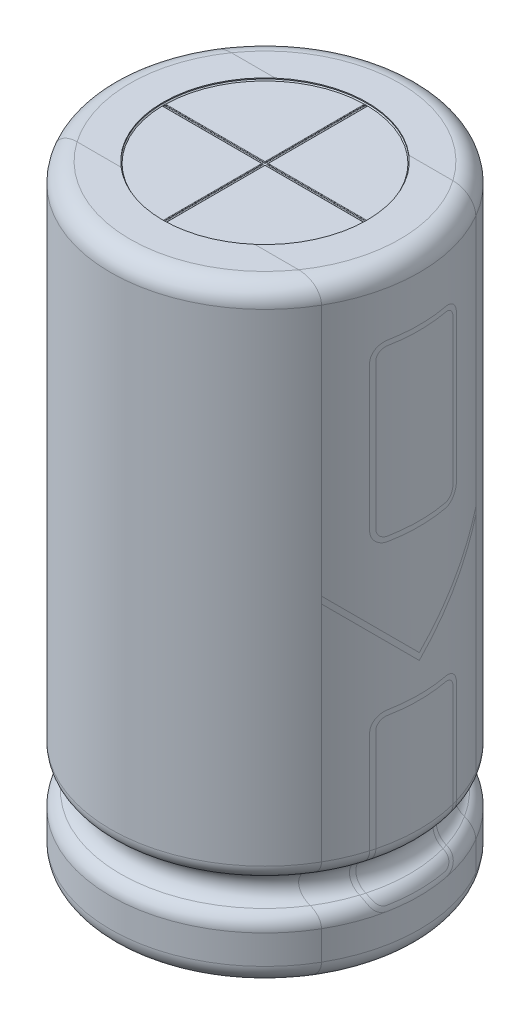
from build123d import *

# Parameters (mm, degrees)
BODY_PLANO_R            = 8
BODY_DEPTH              = 31.5
FILLET_F1_R             = 1
FILLET_F2_R             = 1
HS_CROQUIS_R            = 5.291502622
HUECO_SUPERIOR_DEPTH    = 0.1
HI_CROQUIS_R            = 6.5
HUECO_INFERIOR_DEPTH    = 0.1
CHAFLAN_HUECOS_SIZE     = 0.05
CORTAR_EXTRUIR1_DEPTH   = 0.05
REDONDEO3_R             = 0.025
CROQUIS2_R              = 0.4
SALIENTE_EXTRUIR1_DEPTH = 1.9
REDONDEO1_R             = 0.2


with BuildPart() as part:
    # Body_Plano → Body (new body)
    with BuildSketch(Plane(origin=(0, 0, 0), x_dir=(1, 0, 0), z_dir=(0, 1, 0))):
        with Locations(Location((0, 0, 0), (0, 0, 270))):
            Circle(BODY_PLANO_R)
    extrude(amount=BODY_DEPTH)

    # Cintura_Plano → Cintura (revolve, cut)
    with BuildSketch(Plane.XY, mode=Mode.PRIVATE) as cintura_sk:
        with BuildLine():
            Line((-8, 2.5), (-8, 5.5))
            ThreePointArc((-8, 5.5), (-7.863540864, 5.049306091), (-7.5, 4.75))
            ThreePointArc((-7.5, 4.75), (-7, 4), (-7.5, 3.25))
            ThreePointArc((-7.5, 3.25), (-7.863540864, 2.950693909), (-8, 2.5))
        make_face()
    revolve(cintura_sk.sketch.rotate(Axis((0, 0, 0), (0, 1, 0)), 270), axis=Axis((0, 0, 0), (0, 1, 0)), mode=Mode.SUBTRACT)

    # Fillet F1
    fillet_f1_edges = [part.edges().sort_by_distance(p)[0] for p in [
        (0, 31.5, -8),
    ]]
    fillet(fillet_f1_edges, radius=FILLET_F1_R)

    # Fillet F2
    fillet_f2_edges = [part.edges().sort_by_distance(p)[0] for p in [
        (0, 0, -8),
    ]]
    fillet(fillet_f2_edges, radius=FILLET_F2_R)

    # HS Croquis → Hueco Superior (cut)
    with BuildSketch(Plane(origin=(0, 31.5, 0), x_dir=(1, 0, 0), z_dir=(0, 1, 0))):
        with Locations(Location((0, 0, 0), (0, 0, 270))):
            Circle(HS_CROQUIS_R)
    extrude(amount=-HUECO_SUPERIOR_DEPTH, mode=Mode.SUBTRACT)

    # HI Croquis → Hueco Inferior (cut)
    with BuildSketch(Plane.XZ):
        with Locations(Location((0, 0, 0), (0, 0, 270))):
            Circle(HI_CROQUIS_R)
    extrude(amount=-HUECO_INFERIOR_DEPTH, mode=Mode.SUBTRACT)

    # Chaflan Huecos
    chaflan_huecos_edges = [part.edges().sort_by_distance(p)[0] for p in [
        (0, 31.4, -5.291502622),
        (0, 0.1, 6.5),
    ]]
    chamfer(chaflan_huecos_edges, length=CHAFLAN_HUECOS_SIZE)

    # Croquis3 → Cortar-Extruir1 (cut)
    with BuildSketch(Plane(origin=(0, 31.4, 0), x_dir=(1, 0, 0), z_dir=(0, 1, 0))):
        with BuildLine():
            Line((-0.0625, 5.241129982), (-0.0625, 0.0625))
            Line((-0.0625, 0.0625), (-5.241129982, 0.0625))
            ThreePointArc((-5.241129982, 0.0625), (-5.241502622, 0), (-5.241129982, -0.0625))
            Line((-5.241129982, -0.0625), (-0.0625, -0.0625))
            Line((-0.0625, -0.0625), (-0.0625, -5.241129982))
            ThreePointArc((-0.0625, -5.241129982), (0, -5.241502622), (0.0625, -5.241129982))
            Line((0.0625, -5.241129982), (0.0625, -0.0625))
            Line((0.0625, -0.0625), (5.241129982, -0.0625))
            ThreePointArc((5.241129982, -0.0625), (5.241502622, 0), (5.241129982, 0.0625))
            Line((5.241129982, 0.0625), (0.0625, 0.0625))
            Line((0.0625, 0.0625), (0.0625, 5.241129982))
            ThreePointArc((0.0625, 5.241129982), (0, 5.241502622), (-0.0625, 5.241129982))
        make_face()
    extrude(amount=-CORTAR_EXTRUIR1_DEPTH, mode=Mode.SUBTRACT)

    # Redondeo3
    # the kernel refuses this fillet: 0.025 mm, written as the material it adds along each edge
    with BuildSketch(Plane(origin=(0.0625, 31.35, 0.0625), x_dir=(0, 0, -1), z_dir=(1, 0, 0)), Plane(origin=(-5.303629982, 31.35, 0.0625), x_dir=(0, 0, -1), z_dir=(1, 0, 0)), Plane(origin=(-0.0625, 31.35, -0.0625), x_dir=(0, 0, 1), z_dir=(-1, 0, 0)), Plane(origin=(-0.0625, 31.35, -5.303629982), x_dir=(1, 0, 0), z_dir=(0, 0, 1)), Plane(origin=(0.0625, 31.35, -0.0625), x_dir=(-1, 0, 0), z_dir=(0, 0, -1)), Plane(origin=(5.303629982, 31.35, -0.0625), x_dir=(0, 0, 1), z_dir=(-1, 0, 0))) as redondeo3_piece_1:
        with BuildLine():
            CenterArc((REDONDEO3_R, REDONDEO3_R), REDONDEO3_R, 180, 90)
            Line((0, REDONDEO3_R), (0, 0))
            Line((0, 0), (REDONDEO3_R, 0))
        make_face()
    extrude(amount=5.241129982)
    with BuildSketch(Plane(origin=(0.0625, 31.35, 5.303629982), x_dir=(0, 1, 0), z_dir=(0, 0, -1)), Plane(origin=(-0.0625, 31.35, 0.0625), x_dir=(0, 1, 0), z_dir=(0, 0, 1))) as redondeo3_piece_2:
        with BuildLine():
            CenterArc((REDONDEO3_R, -REDONDEO3_R), REDONDEO3_R, 90, 90)
            Line((0, -REDONDEO3_R), (0, 0))
            Line((0, 0), (REDONDEO3_R, 0))
        make_face()
    extrude(amount=5.241129982)
    with BuildSketch(Plane(origin=(0, 31.35, 0), x_dir=(-0.023846146282340983, 0, 0.9997156402234993), z_dir=(-0.9997156402234993, 0, -0.023846146282340983))) as redondeo3_piece_3:
        with BuildLine():
            CenterArc((5.241502622 - REDONDEO3_R, REDONDEO3_R), REDONDEO3_R, 270, 90)
            Line((5.241502622 - REDONDEO3_R, 0), (5.241502622, 0))
            Line((5.241502622, 0), (5.241502622, REDONDEO3_R))
        make_face()
    revolve(axis=Axis((0, 31.35, 0), (0, 1, 0)), revolution_arc=2.732826119)
    with BuildSketch(Plane(origin=(0, 31.35, 0), x_dir=(-0.9997156402234993, 0, -0.023846146282340826), z_dir=(0.023846146282340826, 0, -0.9997156402234993))) as redondeo3_piece_4:
        with BuildLine():
            CenterArc((5.241502622 - REDONDEO3_R, REDONDEO3_R), REDONDEO3_R, 270, 90)
            Line((5.241502622 - REDONDEO3_R, 0), (5.241502622, 0))
            Line((5.241502622, 0), (5.241502622, REDONDEO3_R))
        make_face()
    revolve(axis=Axis((0, 31.35, 0), (0, 1, 0)), revolution_arc=2.732826119)
    with BuildSketch(Plane(origin=(0, 31.35, 0), x_dir=(0.023846146282340747, 0, -0.9997156402234993), z_dir=(0.9997156402234993, 0, 0.023846146282340747))) as redondeo3_piece_5:
        with BuildLine():
            CenterArc((5.241502622 - REDONDEO3_R, REDONDEO3_R), REDONDEO3_R, 270, 90)
            Line((5.241502622 - REDONDEO3_R, 0), (5.241502622, 0))
            Line((5.241502622, 0), (5.241502622, REDONDEO3_R))
        make_face()
    revolve(axis=Axis((0, 31.35, 0), (0, 1, 0)), revolution_arc=2.732826119)
    with BuildSketch(Plane(origin=(0, 31.35, 0), x_dir=(0.9997156402234993, 0, 0.023846146282341076), z_dir=(-0.023846146282341076, 0, 0.9997156402234993))) as redondeo3_piece_6:
        with BuildLine():
            CenterArc((5.241502622 - REDONDEO3_R, REDONDEO3_R), REDONDEO3_R, 270, 90)
            Line((5.241502622 - REDONDEO3_R, 0), (5.241502622, 0))
            Line((5.241502622, 0), (5.241502622, REDONDEO3_R))
        make_face()
    revolve(axis=Axis((0, 31.35, 0), (0, 1, 0)), revolution_arc=2.732826119)
    with BuildSketch(Plane(origin=(0.0625, 31.35, 5.303629982), x_dir=(0, 1, 0), z_dir=(0, 0, -1))) as redondeo3_piece_7a_section:
        with BuildLine():
            CenterArc((REDONDEO3_R, -REDONDEO3_R), REDONDEO3_R, 90, 90)
            Line((0, -REDONDEO3_R), (0, 0))
            Line((0, 0), (REDONDEO3_R, 0))
        make_face()
    redondeo3_piece_7a = extrude(amount=5.303629982, mode=Mode.PRIVATE)
    redondeo3_piece_7a = split(redondeo3_piece_7a, bisect_by=Plane(origin=(0.0625, 31.35, 0.0625), z_dir=(0, 0, -1)), keep=Keep.TOP, mode=Mode.PRIVATE)
    with BuildSketch(Plane(origin=(0, 31.35, 0.0625), x_dir=(0, 0, -1), z_dir=(1, 0, 0))) as redondeo3_piece_7b_section:
        with BuildLine():
            CenterArc((REDONDEO3_R, REDONDEO3_R), REDONDEO3_R, 180, 90)
            Line((0, REDONDEO3_R), (0, 0))
            Line((0, 0), (REDONDEO3_R, 0))
        make_face()
    redondeo3_piece_7b = extrude(amount=5.303629982, mode=Mode.PRIVATE)
    redondeo3_piece_7b = split(redondeo3_piece_7b, bisect_by=Plane(origin=(0.0625, 31.35, 0.0625), z_dir=(-1, 0, 0)), keep=Keep.TOP, mode=Mode.PRIVATE)
    redondeo3_piece_7 = redondeo3_piece_7a & redondeo3_piece_7b
    add(redondeo3_piece_7)
    with BuildSketch(Plane(origin=(-0.0625, 31.35, 0), x_dir=(0, 1, 0), z_dir=(0, 0, 1))) as redondeo3_piece_8a_section:
        with BuildLine():
            CenterArc((REDONDEO3_R, -REDONDEO3_R), REDONDEO3_R, 90, 90)
            Line((0, -REDONDEO3_R), (0, 0))
            Line((0, 0), (REDONDEO3_R, 0))
        make_face()
    redondeo3_piece_8a = extrude(amount=5.303629982, mode=Mode.PRIVATE)
    redondeo3_piece_8a = split(redondeo3_piece_8a, bisect_by=Plane(origin=(-0.0625, 31.35, 0.0625), z_dir=(0, 0, -1)), keep=Keep.TOP, mode=Mode.PRIVATE)
    with BuildSketch(Plane(origin=(-5.303629982, 31.35, 0.0625), x_dir=(0, 0, -1), z_dir=(1, 0, 0))) as redondeo3_piece_8b_section:
        with BuildLine():
            CenterArc((REDONDEO3_R, REDONDEO3_R), REDONDEO3_R, 180, 90)
            Line((0, REDONDEO3_R), (0, 0))
            Line((0, 0), (REDONDEO3_R, 0))
        make_face()
    redondeo3_piece_8b = extrude(amount=5.303629982, mode=Mode.PRIVATE)
    redondeo3_piece_8b = split(redondeo3_piece_8b, bisect_by=Plane(origin=(-0.0625, 31.35, 0.0625), z_dir=(1, 0, 0)), keep=Keep.TOP, mode=Mode.PRIVATE)
    redondeo3_piece_8 = redondeo3_piece_8a & redondeo3_piece_8b
    add(redondeo3_piece_8)
    with BuildSketch(Plane(origin=(-0.0625, 31.35, -5.303629982), x_dir=(1, 0, 0), z_dir=(0, 0, 1))) as redondeo3_piece_9a_section:
        with BuildLine():
            CenterArc((REDONDEO3_R, REDONDEO3_R), REDONDEO3_R, 180, 90)
            Line((0, REDONDEO3_R), (0, 0))
            Line((0, 0), (REDONDEO3_R, 0))
        make_face()
    redondeo3_piece_9a = extrude(amount=5.303629982, mode=Mode.PRIVATE)
    redondeo3_piece_9a = split(redondeo3_piece_9a, bisect_by=Plane(origin=(-0.0625, 31.35, -0.0625), z_dir=(0, 0, 1)), keep=Keep.TOP, mode=Mode.PRIVATE)
    with BuildSketch(Plane(origin=(0, 31.35, -0.0625), x_dir=(0, 0, 1), z_dir=(-1, 0, 0))) as redondeo3_piece_9b_section:
        with BuildLine():
            CenterArc((REDONDEO3_R, REDONDEO3_R), REDONDEO3_R, 180, 90)
            Line((0, REDONDEO3_R), (0, 0))
            Line((0, 0), (REDONDEO3_R, 0))
        make_face()
    redondeo3_piece_9b = extrude(amount=5.303629982, mode=Mode.PRIVATE)
    redondeo3_piece_9b = split(redondeo3_piece_9b, bisect_by=Plane(origin=(-0.0625, 31.35, -0.0625), z_dir=(1, 0, 0)), keep=Keep.TOP, mode=Mode.PRIVATE)
    redondeo3_piece_9 = redondeo3_piece_9a & redondeo3_piece_9b
    add(redondeo3_piece_9)
    with BuildSketch(Plane(origin=(5.303629982, 31.35, -0.0625), x_dir=(0, 0, 1), z_dir=(-1, 0, 0))) as redondeo3_piece_10a_section:
        with BuildLine():
            CenterArc((REDONDEO3_R, REDONDEO3_R), REDONDEO3_R, 180, 90)
            Line((0, REDONDEO3_R), (0, 0))
            Line((0, 0), (REDONDEO3_R, 0))
        make_face()
    redondeo3_piece_10a = extrude(amount=5.303629982, mode=Mode.PRIVATE)
    redondeo3_piece_10a = split(redondeo3_piece_10a, bisect_by=Plane(origin=(0.0625, 31.35, -0.0625), z_dir=(-1, 0, 0)), keep=Keep.TOP, mode=Mode.PRIVATE)
    with BuildSketch(Plane(origin=(0.0625, 31.35, 0), x_dir=(-1, 0, 0), z_dir=(0, 0, -1))) as redondeo3_piece_10b_section:
        with BuildLine():
            CenterArc((REDONDEO3_R, REDONDEO3_R), REDONDEO3_R, 180, 90)
            Line((0, REDONDEO3_R), (0, 0))
            Line((0, 0), (REDONDEO3_R, 0))
        make_face()
    redondeo3_piece_10b = extrude(amount=5.303629982, mode=Mode.PRIVATE)
    redondeo3_piece_10b = split(redondeo3_piece_10b, bisect_by=Plane(origin=(0.0625, 31.35, -0.0625), z_dir=(0, 0, 1)), keep=Keep.TOP, mode=Mode.PRIVATE)
    redondeo3_piece_10 = redondeo3_piece_10a & redondeo3_piece_10b
    add(redondeo3_piece_10)
    # the kernel refuses this fillet: 0.025 mm, written as the material it takes off along each edge
    with BuildSketch(Plane(origin=(0.0625, 31.4, 5.303629982), x_dir=(0, -1, 0), z_dir=(0, 0, -1))) as redondeo3_2_piece_1_section:
        with BuildLine():
            CenterArc((REDONDEO3_R, -REDONDEO3_R), REDONDEO3_R, 90, 90)
            Line((0, -REDONDEO3_R), (0, 0))
            Line((0, 0), (REDONDEO3_R, 0))
        make_face()
    redondeo3_2_piece_1 = extrude(amount=5.303629982, mode=Mode.PRIVATE)
    redondeo3_2_piece_1 = redondeo3_2_piece_1 & Plane(origin=(0, 31.4, 0), x_dir=(-0.011924061572769477, 0, 0.9999289058506154), z_dir=(0, 1, 0)) * Cylinder(5.241502622, 11, mode=Mode.PRIVATE)
    add(redondeo3_2_piece_1, mode=Mode.SUBTRACT)
    with BuildSketch(Plane(origin=(0, 31.4, 0.0625), x_dir=(0, -1, 0), z_dir=(1, 0, 0))) as redondeo3_2_piece_2_section:
        with BuildLine():
            CenterArc((REDONDEO3_R, -REDONDEO3_R), REDONDEO3_R, 90, 90)
            Line((0, -REDONDEO3_R), (0, 0))
            Line((0, 0), (REDONDEO3_R, 0))
        make_face()
    redondeo3_2_piece_2 = extrude(amount=5.303629982, mode=Mode.PRIVATE)
    redondeo3_2_piece_2 = redondeo3_2_piece_2 & Plane(origin=(0, 31.4, 0), x_dir=(0.9999289058506154, 0, 0.011924061572769559), z_dir=(0, 1, 0)) * Cylinder(5.241502622, 11, mode=Mode.PRIVATE)
    add(redondeo3_2_piece_2, mode=Mode.SUBTRACT)
    with BuildSketch(Plane(origin=(5.303629982, 31.4, -0.0625), x_dir=(0, -1, 0), z_dir=(-1, 0, 0))) as redondeo3_2_piece_3_section:
        with BuildLine():
            CenterArc((REDONDEO3_R, -REDONDEO3_R), REDONDEO3_R, 90, 90)
            Line((0, -REDONDEO3_R), (0, 0))
            Line((0, 0), (REDONDEO3_R, 0))
        make_face()
    redondeo3_2_piece_3 = extrude(amount=5.303629982, mode=Mode.PRIVATE)
    redondeo3_2_piece_3 = redondeo3_2_piece_3 & Plane(origin=(0, 31.4, 0), x_dir=(0.9999289058506154, 0, 0.011924061572769559), z_dir=(0, 1, 0)) * Cylinder(5.241502622, 11, mode=Mode.PRIVATE)
    add(redondeo3_2_piece_3, mode=Mode.SUBTRACT)
    with BuildSketch(Plane(origin=(0.0625, 31.4, 0), x_dir=(0, -1, 0), z_dir=(0, 0, -1))) as redondeo3_2_piece_4_section:
        with BuildLine():
            CenterArc((REDONDEO3_R, -REDONDEO3_R), REDONDEO3_R, 90, 90)
            Line((0, -REDONDEO3_R), (0, 0))
            Line((0, 0), (REDONDEO3_R, 0))
        make_face()
    redondeo3_2_piece_4 = extrude(amount=5.303629982, mode=Mode.PRIVATE)
    redondeo3_2_piece_4 = redondeo3_2_piece_4 & Plane(origin=(0, 31.4, 0), x_dir=(0.011924061572769228, 0, -0.9999289058506154), z_dir=(0, 1, 0)) * Cylinder(5.241502622, 11, mode=Mode.PRIVATE)
    add(redondeo3_2_piece_4, mode=Mode.SUBTRACT)
    with BuildSketch(Plane(origin=(0, 31.4, -0.0625), x_dir=(0, -1, 0), z_dir=(-1, 0, 0))) as redondeo3_2_piece_5_section:
        with BuildLine():
            CenterArc((REDONDEO3_R, -REDONDEO3_R), REDONDEO3_R, 90, 90)
            Line((0, -REDONDEO3_R), (0, 0))
            Line((0, 0), (REDONDEO3_R, 0))
        make_face()
    redondeo3_2_piece_5 = extrude(amount=5.303629982, mode=Mode.PRIVATE)
    redondeo3_2_piece_5 = redondeo3_2_piece_5 & Plane(origin=(0, 31.4, 0), x_dir=(-0.9999289058506154, 0, -0.011924061572769313), z_dir=(0, 1, 0)) * Cylinder(5.241502622, 11, mode=Mode.PRIVATE)
    add(redondeo3_2_piece_5, mode=Mode.SUBTRACT)
    with BuildSketch(Plane(origin=(-0.0625, 31.4, -5.303629982), x_dir=(0, -1, 0), z_dir=(0, 0, 1))) as redondeo3_2_piece_6_section:
        with BuildLine():
            CenterArc((REDONDEO3_R, -REDONDEO3_R), REDONDEO3_R, 90, 90)
            Line((0, -REDONDEO3_R), (0, 0))
            Line((0, 0), (REDONDEO3_R, 0))
        make_face()
    redondeo3_2_piece_6 = extrude(amount=5.303629982, mode=Mode.PRIVATE)
    redondeo3_2_piece_6 = redondeo3_2_piece_6 & Plane(origin=(0, 31.4, 0), x_dir=(0.011924061572769228, 0, -0.9999289058506154), z_dir=(0, 1, 0)) * Cylinder(5.241502622, 11, mode=Mode.PRIVATE)
    add(redondeo3_2_piece_6, mode=Mode.SUBTRACT)
    with BuildSketch(Plane(origin=(-5.303629982, 31.4, 0.0625), x_dir=(0, 0, 1), z_dir=(1, 0, 0))) as redondeo3_2_piece_7_section:
        with BuildLine():
            CenterArc((REDONDEO3_R, REDONDEO3_R), REDONDEO3_R, 180, 90)
            Line((0, REDONDEO3_R), (0, 0))
            Line((0, 0), (REDONDEO3_R, 0))
        make_face()
    redondeo3_2_piece_7 = extrude(amount=5.303629982, mode=Mode.PRIVATE)
    redondeo3_2_piece_7 = redondeo3_2_piece_7 & Plane(origin=(0, 31.4, 0), x_dir=(-0.9999289058506154, 0, -0.011924061572769313), z_dir=(0, 1, 0)) * Cylinder(5.241502622, 11, mode=Mode.PRIVATE)
    add(redondeo3_2_piece_7, mode=Mode.SUBTRACT)
    with BuildSketch(Plane(origin=(-0.0625, 31.4, 0), x_dir=(-1, 0, 0), z_dir=(0, 0, 1))) as redondeo3_2_piece_8_section:
        with BuildLine():
            CenterArc((REDONDEO3_R, REDONDEO3_R), REDONDEO3_R, 180, 90)
            Line((0, REDONDEO3_R), (0, 0))
            Line((0, 0), (REDONDEO3_R, 0))
        make_face()
    redondeo3_2_piece_8 = extrude(amount=5.303629982, mode=Mode.PRIVATE)
    redondeo3_2_piece_8 = redondeo3_2_piece_8 & Plane(origin=(0, 31.4, 0), x_dir=(-0.011924061572769477, 0, 0.9999289058506154), z_dir=(0, 1, 0)) * Cylinder(5.241502622, 11, mode=Mode.PRIVATE)
    add(redondeo3_2_piece_8, mode=Mode.SUBTRACT)

    # Croquis2 → Saliente-Extruir1 (add)
    with BuildSketch(Plane(origin=(0, 0.1, 0), x_dir=(-1, 0, 0), z_dir=(0, -1, 0))):
        with Locations(Location((-3.75, 0, 0), (0, 0, 270))):
            Circle(CROQUIS2_R)
        with Locations(Location((3.75, 0, 0), (0, 0, 270))):
            Circle(CROQUIS2_R)
    extrude(amount=SALIENTE_EXTRUIR1_DEPTH)

    # Redondeo1
    redondeo1_edges = [part.edges().sort_by_distance(p)[0] for p in [
        (3.75, -1.8, -0.4),
        (-3.75, -1.8, -0.4),
    ]]
    fillet(redondeo1_edges, radius=REDONDEO1_R)


solid = part.part
